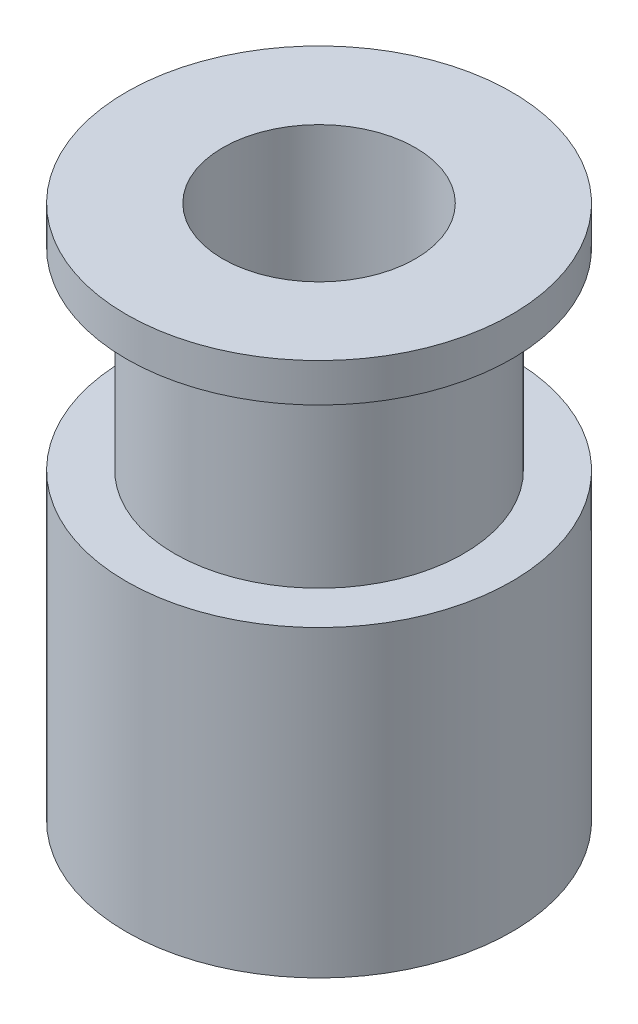
from build123d import *

# Parameters (mm, degrees)
SKETCH1_R           = 10
BOSS_EXTRUDE2_DEPTH = 10
CUT_EXTRUDE3_REACH  = 19.321
SKETCH5_R           = 1.5
SKETCH6_R           = 10
BOSS_EXTRUDE3_DEPTH = 5.75
SKETCH7_R           = 5
CUT_EXTRUDE4_DEPTH  = 5.75
SKETCH8_R           = 7.5
BOSS_EXTRUDE4_DEPTH = 10
SKETCH9_R           = 10
BOSS_EXTRUDE5_DEPTH = 2
CUT_EXTRUDE5_REACH  = 33.146
SKETCH10_R          = 5


with BuildPart() as part:
    # Sketch1 → Boss-Extrude2 (new body)
    with BuildSketch(Plane(origin=(0, 0, 0), x_dir=(1, 0, 0), z_dir=(0, 1, 0))):
        Circle(SKETCH1_R)
    extrude(amount=BOSS_EXTRUDE2_DEPTH)

    # Sketch5 → Cut-Extrude3 (cut, up to next)
    with BuildSketch(Plane(origin=(0, 10, 0), x_dir=(-1, 0, 0), z_dir=(0, 1, 0)), mode=Mode.PRIVATE) as cut_extrude3_sk1:
        Circle(SKETCH5_R)
    cut_extrude3_tool1 = extrude(cut_extrude3_sk1.sketch, amount=-CUT_EXTRUDE3_REACH, mode=Mode.PRIVATE) & part.part
    add(cut_extrude3_tool1.solids().sort_by_distance((0, 10, 0))[0], mode=Mode.SUBTRACT)

    # Sketch6 → Boss-Extrude3 (add)
    with BuildSketch(Plane(origin=(0, 10, 0), x_dir=(-1, 0, 0), z_dir=(0, 1, 0))):
        Circle(SKETCH6_R)
    extrude(amount=BOSS_EXTRUDE3_DEPTH)

    # Sketch7 → Cut-Extrude4 (cut)
    with BuildSketch(Plane(origin=(0, 15.75, 0), x_dir=(-1, 0, 0), z_dir=(0, 1, 0))):
        Circle(SKETCH7_R)
    extrude(amount=-CUT_EXTRUDE4_DEPTH, mode=Mode.SUBTRACT)

    # Sketch8 → Boss-Extrude4 (add)
    with BuildSketch(Plane(origin=(0, 15.75, 0), x_dir=(-1, 0, 0), z_dir=(0, 1, 0))):
        Circle(SKETCH8_R)
    extrude(amount=BOSS_EXTRUDE4_DEPTH)

    # Sketch9 → Boss-Extrude5 (add)
    with BuildSketch(Plane(origin=(0, 25.75, 0), x_dir=(-1, 0, 0), z_dir=(0, 1, 0))):
        Circle(SKETCH9_R)
    extrude(amount=BOSS_EXTRUDE5_DEPTH)

    # Sketch10 → Cut-Extrude5 (cut, up to next)
    with BuildSketch(Plane(origin=(0, 27.75, 0), x_dir=(-1, 0, 0), z_dir=(0, 1, 0)), mode=Mode.PRIVATE) as cut_extrude5_sk1:
        Circle(SKETCH10_R)
    cut_extrude5_tool1 = extrude(cut_extrude5_sk1.sketch, amount=-CUT_EXTRUDE5_REACH, mode=Mode.PRIVATE) & part.part
    add(cut_extrude5_tool1.solids().sort_by_distance((0, 27.75, 0))[0], mode=Mode.SUBTRACT)


solid = part.part
